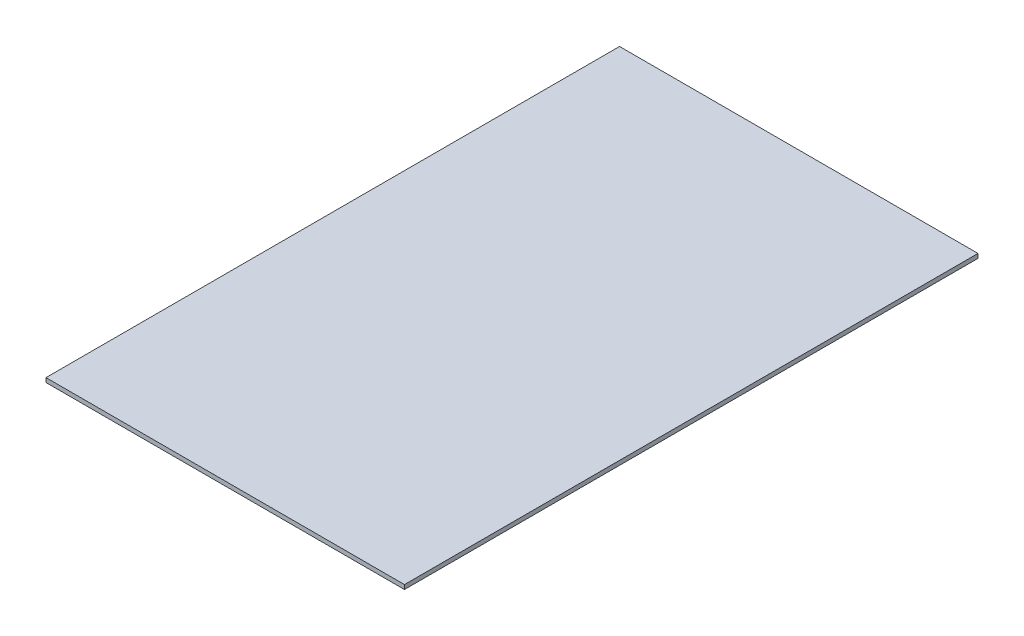
from build123d import *

# Parameters (mm, degrees)
SKETCH2_W           = 250
SKETCH2_H           = 400
BOSS_EXTRUDE1_DEPTH = 3


with BuildPart() as part:
    # Sketch2 → Boss-Extrude1 (new body)
    with BuildSketch(Plane(origin=(0, 0, 0), x_dir=(1, 0, 0), z_dir=(0, 1, 0))):
        with Locations((125, 200)):
            Rectangle(SKETCH2_W, SKETCH2_H)
    extrude(amount=BOSS_EXTRUDE1_DEPTH)


solid = part.part
